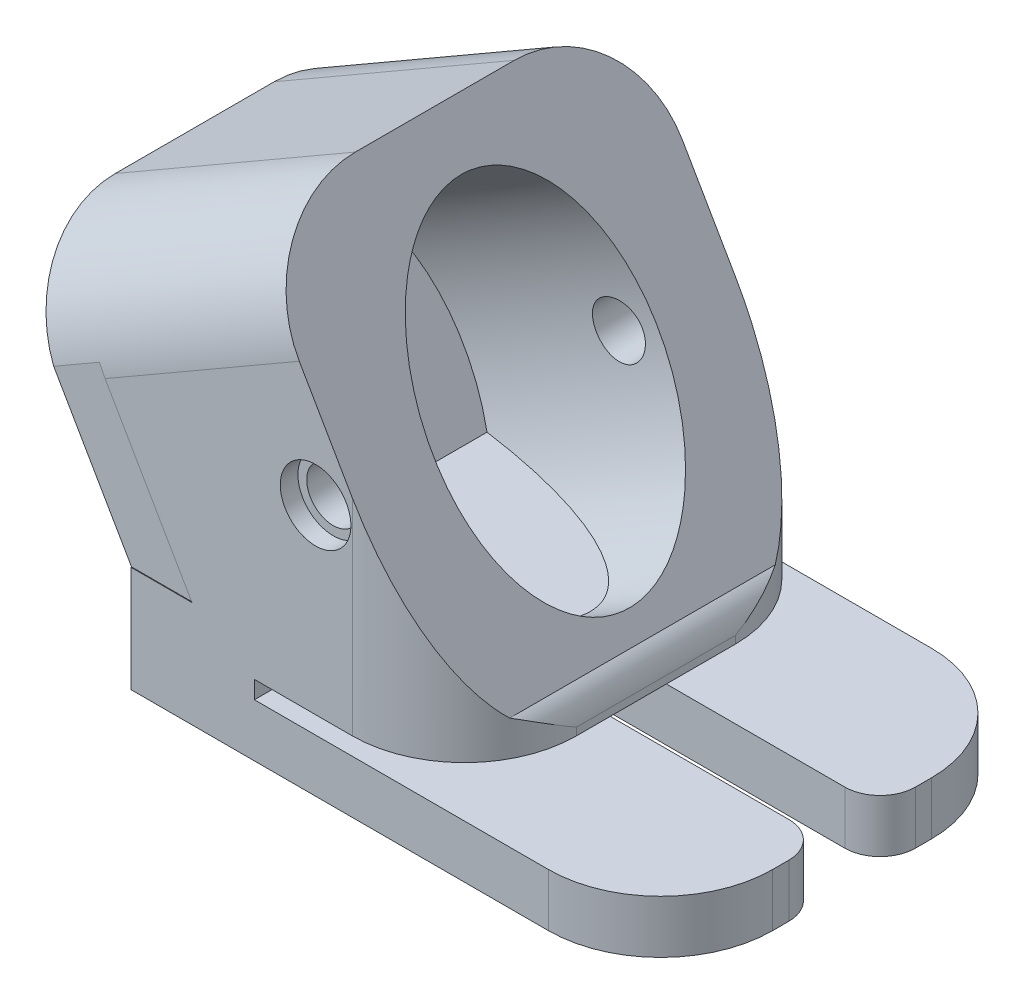
from build123d import *

# Parameters (mm, degrees)
SKETCH2_W           = 21.7
SKETCH2_H           = 25.05
SKETCH2_RX          = 9.525
SKETCH2_RY          = 6.35
BOSS_EXTRUDE1_DEPTH = 12.7
SKETCH3_W           = 21.660653916
SKETCH3_H           = 25.05
BOSS_EXTRUDE2_DEPTH = 3
SKETCH5_W           = 18.892037138
SKETCH5_H           = 21.7
BOSS_EXTRUDE3_DEPTH = 2
SKETCH6_W           = 30
SKETCH6_H           = 21.7
BOSS_EXTRUDE4_DEPTH = 4
SKETCH7_W           = 21.7
SKETCH7_H           = 1
SKETCH7_W_2         = 3.175
SKETCH7_H_2         = 3
CUT_EXTRUDE2_DEPTH  = 23
SKETCH7_3_W         = 21.7
SKETCH7_3_H         = 7.272473706
CUT_EXTRUDE3_DEPTH  = 44.803879418
SKETCH11_R          = 1
CUT_EXTRUDE8_DEPTH  = 33.487034031
CUT_EXTRUDE4_REACH  = 47.088
SKETCH9_R           = 1.5
SKETCH10_R          = 2
CUT_EXTRUDE7_DEPTH  = 1
FILLET5_R           = 6.35
FILLET6_R           = 2
FILLET7_R           = 2


with BuildPart() as part:
    # Sketch2 → Boss-Extrude1 (new body)
    with BuildSketch(Plane(origin=(16.497783942, 9.525, 0), x_dir=(0, 0, -1), z_dir=(0.8660254037844379, 0.5000000000000013, 0))):
        Rectangle(SKETCH2_W, SKETCH2_H)
        with Locations(Location((0, 0), (0, 0, 90))):
            Ellipse(SKETCH2_RX, SKETCH2_RY, mode=Mode.SUBTRACT)
    extrude(amount=-BOSS_EXTRUDE1_DEPTH)

    # Sketch3 → Boss-Extrude2 (add)
    with BuildSketch(Plane(origin=(5.499261314, 3.175, 0), x_dir=(0, 0, 1), z_dir=(-0.8660254037844379, -0.5000000000000014, 0))):
        with Locations((-0.019673042, 0)):
            Rectangle(SKETCH3_W, SKETCH3_H)
    extrude(amount=BOSS_EXTRUDE2_DEPTH)

    # Sketch5 → Boss-Extrude3 (add)
    with BuildSketch(Plane(origin=(0, 0, 0), x_dir=(-1, 0, 0), z_dir=(0, 1, 0))):
        with Locations((-13.314265373, 0)):
            Rectangle(SKETCH5_W, SKETCH5_H)
    extrude(amount=-BOSS_EXTRUDE3_DEPTH)

    # Sketch6 → Boss-Extrude4 (add)
    with BuildSketch(Plane.XZ.offset(2)):
        with Locations((18.868246804, 0)):
            Rectangle(SKETCH6_W, SKETCH6_H)
    extrude(amount=BOSS_EXTRUDE4_DEPTH)

    # Sketch7 → Cut-Extrude2 (cut)
    with BuildSketch(Plane(origin=(33.868246804, 0, 0), x_dir=(0, 0, -1), z_dir=(1, 0, 0))):
        with Locations((0, -2.5)):
            Rectangle(SKETCH7_W, SKETCH7_H)
        with Locations((0, -4.5)):
            Rectangle(SKETCH7_W_2, SKETCH7_H_2)
    extrude(amount=-CUT_EXTRUDE2_DEPTH, mode=Mode.SUBTRACT)

    # Sketch7<3> → Cut-Extrude3 (cut, through all)
    with BuildSketch(Plane(origin=(33.868246804, 0, 0), x_dir=(0, 0, -1), z_dir=(1, 0, 0))):
        with Locations((0, -9.636236853)):
            Rectangle(SKETCH7_3_W, SKETCH7_3_H)
    extrude(amount=-CUT_EXTRUDE3_DEPTH, mode=Mode.SUBTRACT)

    # Sketch11 → Cut-Extrude8 (cut, through all)
    with BuildSketch(Plane(origin=(19.672783942, 0.194872981, 0), x_dir=(0, 0, -1), z_dir=(-1, 0, 0))):
        with Locations(Location((0, -3.830865705, 0), (0, 0, 90))):
            Circle(SKETCH11_R)
    extrude(amount=CUT_EXTRUDE8_DEPTH, mode=Mode.SUBTRACT)

    # Sketch9 → Cut-Extrude4 (cut, up to next)
    with BuildSketch(Plane(origin=(0, 0, -10.85), x_dir=(-1, 0, 0), z_dir=(0, 0, -1)), mode=Mode.PRIVATE) as cut_extrude4_sk1:
        with Locations((-14.332720433, 8.275)):
            Circle(SKETCH9_R)
    cut_extrude4_tool1 = extrude(cut_extrude4_sk1.sketch, amount=-CUT_EXTRUDE4_REACH, mode=Mode.PRIVATE) & part.part
    cut_extrude4 = cut_extrude4_tool1.solids().sort_by_distance((14.33272, 8.275, -10.85))[0]
    add(cut_extrude4, mode=Mode.SUBTRACT)

    # Sketch10 → Cut-Extrude7 (cut)
    with BuildSketch(Plane(origin=(0, 0, -10.85), x_dir=(-1, 0, 0), z_dir=(0, 0, -1))):
        with Locations((-14.332720433, 8.275)):
            Circle(SKETCH10_R)
    cut_extrude7 = extrude(amount=-CUT_EXTRUDE7_DEPTH, mode=Mode.SUBTRACT)

    # Mirror1: Cut-Extrude4, Cut-Extrude7 across plane
    add(cut_extrude4.mirror(Plane.XY), mode=Mode.SUBTRACT)
    add(cut_extrude7.mirror(Plane.XY), mode=Mode.SUBTRACT)

    # Fillet5
    fillet5_edges = [part.edges().sort_by_distance(p)[0] for p in [
        (33.868246804, -4.5, 10.85),
        (33.868246804, -4.5, -10.85),
        (22.760283942, -1, -10.85),
        (22.760283942, -1, 10.85),
        (4.736022628, 17.196968182, 10.85),
        (3.436984522, 16.446968182, -10.85),
    ]]
    fillet(fillet5_edges, radius=FILLET5_R)

    # Fillet6
    fillet6_edges = [part.edges().sort_by_distance(p)[0] for p in [
        (33.868246804, -4.5, 1.5875),
        (33.868246804, -4.5, -1.5875),
    ]]
    fillet(fillet6_edges, radius=FILLET6_R)

    # Fillet7
    # the kernel refuses this fillet: 2 mm, written as the material it takes off along each edge
    with BuildSketch(Plane(origin=(22.760283942, 0, 8.429393602), x_dir=(-1, 0, 0), z_dir=(0, 0, -1))) as fillet7_piece_1:
        with BuildLine():
            CenterArc((2, -1.571757441), FILLET7_R, 128.197977663, 51.802022337)
            Line((0, -1.571757441), (-0.04, -1.571757441))
            Line((-0.04, -1.571757441), (-0.04, 0))
            Line((-0.04, 0), (0, 0.04))
            ThreePointArc((0, 0.04), (0.381619343, 0.04), (0.73850346, 0.031435149))
            Line((0.73850346, 0.031435149), (0.763238686, 0))
        make_face()
    extrude(amount=16.858787203, mode=Mode.SUBTRACT)


solid = part.part
